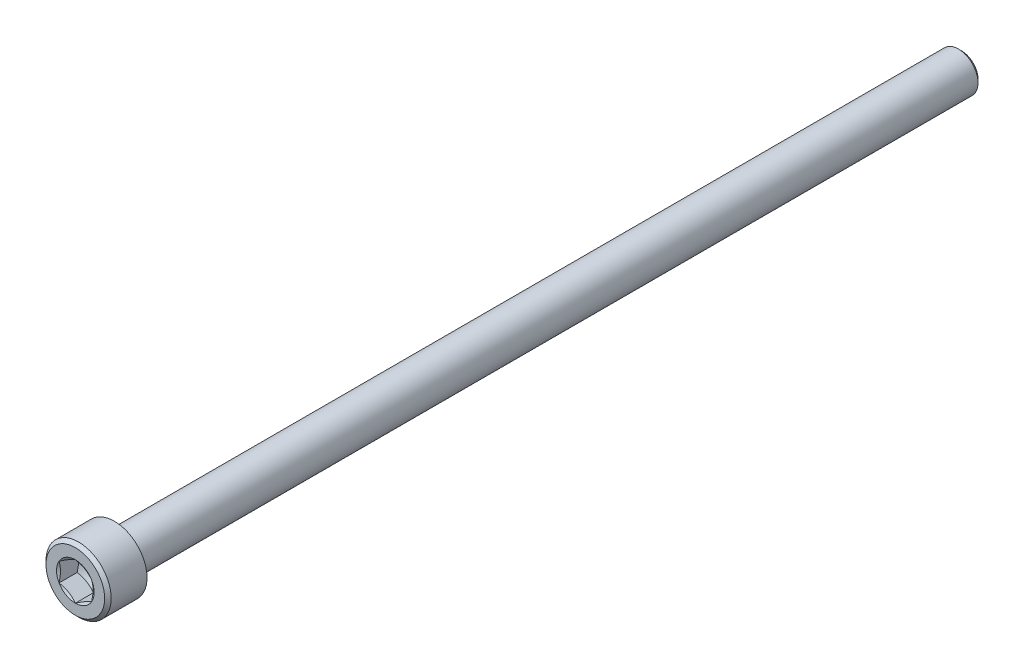
from build123d import *

# Parameters (mm, degrees)
CHAMFER1_SIZE      = 0.5
CUT_EXTRUDE1_REACH = 138.184
FILLET2_R          = 0.25


with BuildPart() as part:
    # Sketch1 → Revolve1 (revolve)
    with BuildSketch(Plane(origin=(0, 0, 0), x_dir=(0, 0, -1), z_dir=(1, 0, 0))):
        Polygon((0, 5), (-6, 5), (-6, 0), (130, 0), (130, 3), (0, 3), align=None)
    revolve(axis=Axis((0, 0, 6), (0, 0, -1)))

    # Sketch7 → Cut-Revolve2 (revolve, cut)
    with BuildSketch(Plane(origin=(0, 0, 0), x_dir=(0, 0, -1), z_dir=(1, 0, 0))):
        Polygon((-6, 0), (-6, 2.5), (-3, 2.5), (-1.556624327, 0), align=None)
    revolve(axis=Axis((0, 0, 6), (0, 0, -1)), mode=Mode.SUBTRACT)

    # Chamfer1
    chamfer1_edges = [part.edges().sort_by_distance(p)[0] for p in [
        (0, -3, -130),
        (0, -5, 6),
    ]]
    chamfer(chamfer1_edges, length=CHAMFER1_SIZE)

    # Cut-Extrude1: up to this cone (the profile starts inside it)
    cut_extrude1_end = Plane(origin=(0, 0, 6), z_dir=(0, 0, 1)).offset(-4.443374673) * Cone(1.732e-06, 261.234013639, 150.823527096, align=(Align.CENTER, Align.CENTER, Align.MIN), mode=Mode.PRIVATE)
    # Sketch8 → Cut-Extrude1 (cut, up to the surface)
    with BuildSketch(Plane.XY.offset(6), mode=Mode.PRIVATE) as cut_extrude1_sk1:
        Polygon((0, 2.886751346), (-2.5, 1.443375673), (-2.5, -1.443375673), (0, -2.886751346), (2.5, -1.443375673), (2.5, 1.443375673), align=None)
    cut_extrude1_tool1 = extrude(cut_extrude1_sk1.sketch, amount=-CUT_EXTRUDE1_REACH, mode=Mode.PRIVATE) & cut_extrude1_end
    add(cut_extrude1_tool1.solids().sort_by_distance((0, 0, 6))[0], mode=Mode.SUBTRACT)

    # Sketch9 → Cut-Revolve3 (revolve, cut)
    with BuildSketch(Plane(origin=(0, 0, 0), x_dir=(0, 0, -1), z_dir=(1, 0, 0))):
        Polygon((-6.5, 3.75277675), (-6.5, 2.5), (-5.776709006, 2.5), align=None)
    revolve(axis=Axis((0, 0, 6), (0, 0, -1)), mode=Mode.SUBTRACT)

    # Fillet2
    fillet2_edges = [part.edges().sort_by_distance(p)[0] for p in [
        (0, -3, 0),
    ]]
    fillet(fillet2_edges, radius=FILLET2_R)


solid = part.part
